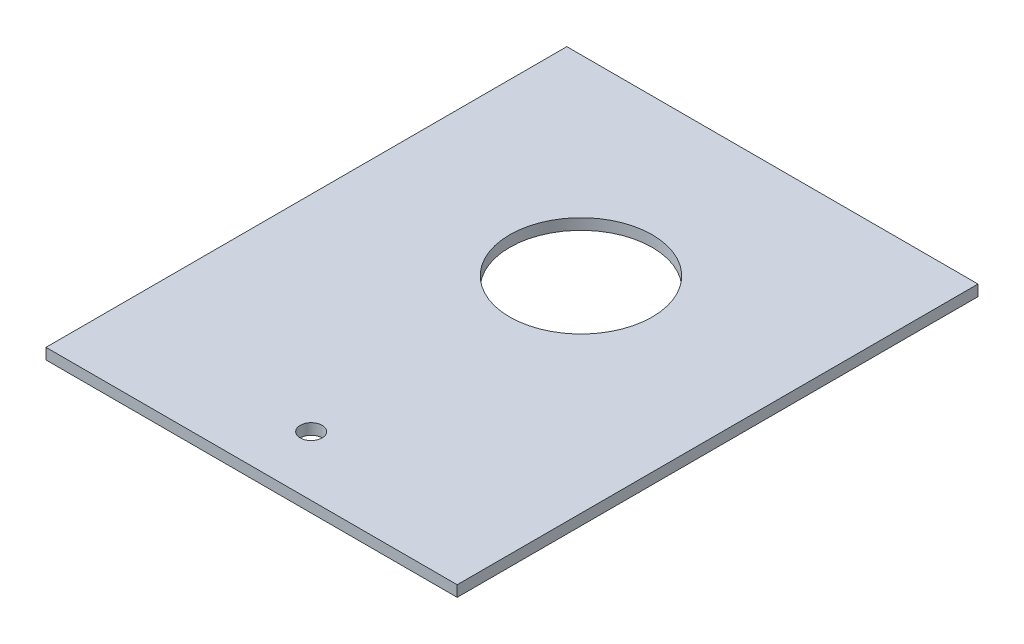
from build123d import *

# Parameters (mm, degrees)
SKETCH1_W           = 150
SKETCH1_H           = 190
BOSS_EXTRUDE1_DEPTH = 4
HOLE1_D             = 52
HOLE1_DEPTH         = 100
HOLE2_D             = 8
HOLE2_DEPTH         = 100


with BuildPart() as part:
    # Sketch1 → Boss-Extrude1 (new body)
    with BuildSketch(Plane(origin=(0, 32, 0), x_dir=(1, 0, 0), z_dir=(0, 1, 0))):
        with Locations((0, -25.157065581)):
            Rectangle(SKETCH1_W, SKETCH1_H)
    extrude(amount=BOSS_EXTRUDE1_DEPTH)

    # Hole1
    with Locations(Plane(origin=(0, 36, 0), x_dir=(1, 0, 0), z_dir=(0, 1, 0))):
        with Locations((0, 0)):
            Hole(HOLE1_D / 2, depth=HOLE1_DEPTH)

    # Hole2
    with Locations(Plane(origin=(0, 36, 0), x_dir=(1, 0, 0), z_dir=(0, 1, 0))):
        with Locations((0, -98.42)):
            Hole(HOLE2_D / 2, depth=HOLE2_DEPTH)


solid = part.part
